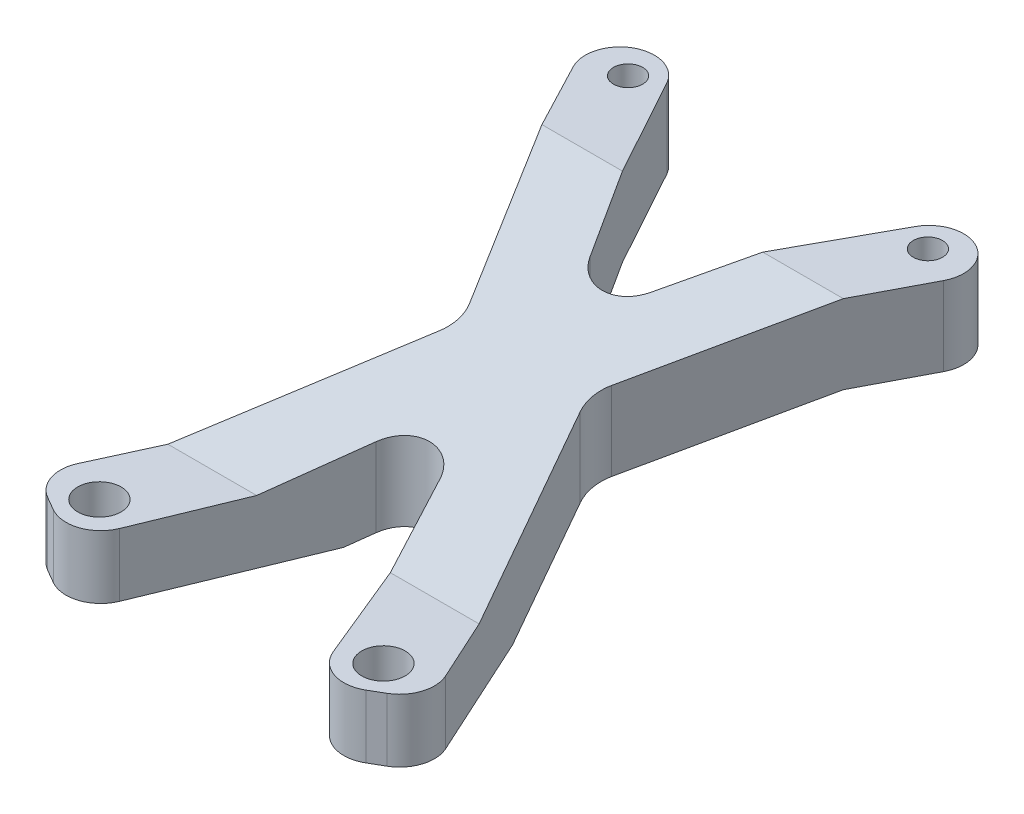
from build123d import *

# Parameters (mm, degrees)
SKETCH1_W               = 26
SKETCH1_H               = 41
SKETCH1_R               = 1.375
SKETCH1_R_2             = 0.925
SKETCH1_H_2             = 4.4
BOSS_EXTRUDE1_DEPTH     = 6
SKETCH2_R               = 0.925
SKETCH2_R_2             = 1.375
BOSS_EXTRUDE2_DEPTH     = 15
CUT_EXTRUDE2_DEPTH      = 42.677451937
CUT_EXTRUDE2_DEPTH_BACK = 42.677451937
SKETCH4_W               = 26
SKETCH4_H               = 45.4
CUT_EXTRUDE1_DEPTH      = 7
FILLET1_R               = 2.2
FILLET2_R               = 2.2


with BuildPart() as part:
    # Sketch1 → Boss-Extrude1 (new body)
    # profile 1 of 2: a face of its own
    with BuildSketch(Plane(origin=(0, 0, 0), x_dir=(1, 0, 0), z_dir=(0, 1, 0))):
        Rectangle(SKETCH1_W, SKETCH1_H)
        with Locations(Location((-9, -18, 0), (0, 0, 270))):
            Circle(SKETCH1_R, mode=Mode.SUBTRACT)
        with BuildLine():
            ThreePointArc((10.375, -18), (9, -19.375), (7.625, -18))
            ThreePointArc((7.625, -18), (9, -16.625), (10.375, -18))
        make_face(mode=Mode.SUBTRACT)
        with Locations(Location((-9.5, 16, 0), (0, 0, 270))):
            Circle(SKETCH1_R_2, mode=Mode.SUBTRACT)
        with BuildLine():
            ThreePointArc((10.425, 16), (9.5, 15.075), (8.575, 16))
            ThreePointArc((8.575, 16), (9.5, 16.925), (10.425, 16))
        make_face(mode=Mode.SUBTRACT)
    # profile 2 of 2: a face of its own
    with BuildSketch(Plane(origin=(0, 0, 0), x_dir=(1, 0, 0), z_dir=(0, 1, 0))):
        with Locations((0, -22.7)):
            Rectangle(SKETCH1_W, SKETCH1_H_2)
    extrude(amount=BOSS_EXTRUDE1_DEPTH)

    # Sketch2 → Boss-Extrude2 (add)
    # profile 1 of 6: a face of its own
    with BuildSketch(Plane(origin=(0, 6, 0), x_dir=(1, 0, 0), z_dir=(0, 1, 0))):
        Polygon((12.587244228, 16.385905528), (10.85066935, 17.736574878), (9.114094472, 19.087244228), (0, 2.5), (4, 2.5), (4, 0), align=None)
        with BuildLine():
            ThreePointArc((10.425, 16), (8.669058384, 15.593599912), (10.067895068, 16.730150801))
            ThreePointArc((10.067895068, 16.730150801), (10.330941616, 16.406400088), (10.425, 16))
        make_face(mode=Mode.SUBTRACT)
    # profile 2 of 6: a face of its own
    with BuildSketch(Plane(origin=(0, 6, 0), x_dir=(1, 0, 0), z_dir=(0, 1, 0))):
        Polygon((-4, 0), (-4, 2.5), (0, 2.5), (-9.114094472, 19.087244228), (-12.587244228, 16.385905528), align=None)
        with Locations(Location((-9.5, 16, 0), (0, 0, 270))):
            Circle(SKETCH2_R, mode=Mode.SUBTRACT)
    # profile 3 of 6: a face of its own
    with BuildSketch(Plane(origin=(0, 6, 0), x_dir=(1, 0, 0), z_dir=(0, 1, 0))):
        Polygon((0, 2.5), (-4, 2.5), (-4, 0), (-4, -2.5), (0, -2.5), align=None)
    # profile 4 of 6: a face of its own
    with BuildSketch(Plane(origin=(0, 6, 0), x_dir=(1, 0, 0), z_dir=(0, 1, 0))):
        Polygon((4, 2.5), (0, 2.5), (0, -2.5), (4, -2.5), (4, 0), align=None)
    # profile 5 of 6: a face of its own
    with BuildSketch(Plane(origin=(0, 6, 0), x_dir=(1, 0, 0), z_dir=(0, 1, 0))):
        Polygon((12.482501962, -18.524099305), (4, 0), (4, -2.5), (0, -2.5), (7.724231954, -21.282516701), (10.103366958, -19.903308003), align=None)
        with BuildLine():
            ThreePointArc((10.375, -18), (10.191392249, -18.686447019), (9.689604349, -19.189567502))
            ThreePointArc((9.689604349, -19.189567502), (7.808607751, -17.313552981), (10.375, -18))
        make_face(mode=Mode.SUBTRACT)
    # profile 6 of 6: a face of its own
    with BuildSketch(Plane(origin=(0, 6, 0), x_dir=(1, 0, 0), z_dir=(0, 1, 0))):
        Polygon((-4, -2.5), (-4, 0), (-12.482501962, -18.524099305), (-7.724231954, -21.282516701), (0, -2.5), align=None)
        with Locations(Location((-9, -18, 0), (0, 0, 270))):
            Circle(SKETCH2_R_2, mode=Mode.SUBTRACT)
    extrude(amount=BOSS_EXTRUDE2_DEPTH)

    # Sketch6 → Cut-Extrude2 (cut, two sides: drawn at the far end of the back side and taken through both)
    with BuildSketch(Plane(origin=(13, 0, 0), x_dir=(0, 0, -1), z_dir=(1, 0, 0)).offset(-CUT_EXTRUDE2_DEPTH_BACK)):
        Polygon((-21.28, 17), (-21.28, 11), (-12.8, 11), (10.59, 17), align=None)
        Polygon((10.59, 12), (-12.8, 6), (19.09, 6), (19.09, 12), align=None)
        Polygon((-21.28, 21.511868699), (-21.28, 17), (10.59, 17), (19.087244228, 17), (19.087244228, 21.511868699), align=None)
    extrude(amount=CUT_EXTRUDE2_DEPTH + CUT_EXTRUDE2_DEPTH_BACK, mode=Mode.SUBTRACT)

    # Sketch4 → Cut-Extrude1 (cut)
    with BuildSketch(Plane.XZ):
        with Locations((0, 2.2)):
            Rectangle(SKETCH4_W, SKETCH4_H)
    extrude(amount=-CUT_EXTRUDE1_DEPTH, mode=Mode.SUBTRACT)

    # Fillet1
    # the kernel refuses this fillet: 2.2 mm, written as the material it takes off along each edge
    with BuildSketch(Plane(origin=(12.587244228, 7.402722975, -16.385905528), x_dir=(-0.46418305146339667, 0, 0.8857392927572592), z_dir=(0, 1, 0))) as fillet1_piece_1:
        with BuildLine():
            CenterArc((FILLET1_R * 0.83586855008, -FILLET1_R), FILLET1_R, 90, 79.782379698)
            Line((-FILLET1_R * 0.148272552074, -FILLET1_R * 0.822612596131), (0, 0))
            Line((0, 0), (FILLET1_R * 0.83586855008, 0))
        make_face()
    extrude(amount=14.194554051, mode=Mode.SUBTRACT)
    with BuildSketch(Plane(origin=(9.114094472, 5.550330565, -19.087244228), x_dir=(-0.48155808709989106, 0, 0.8764141764877459), z_dir=(0, 1, 0))) as fillet1_piece_2:
        with BuildLine():
            CenterArc((FILLET1_R * 1.17266716994, FILLET1_R), FILLET1_R, 170.912229019, 99.087770981)
            Line((FILLET1_R * 0.185219628956, FILLET1_R * 1.15794731336), (0, 0))
            Line((0, 0), (FILLET1_R * 1.17266716994, 0))
        make_face()
    extrude(amount=17.899338869, mode=Mode.SUBTRACT)
    with BuildSketch(Plane(origin=(-9.114094472, 5.550330565, -19.087244228), x_dir=(0.4815580870998917, 0, 0.8764141764877456), z_dir=(0, 1, 0))) as fillet1_piece_3:
        with BuildLine():
            CenterArc((FILLET1_R * 1.17266716994, -FILLET1_R), FILLET1_R, 90, 99.087770981)
            Line((FILLET1_R * 0.185219628956, -FILLET1_R * 1.15794731336), (0, 0))
            Line((0, 0), (FILLET1_R * 1.17266716994, 0))
        make_face()
    extrude(amount=17.899338869, mode=Mode.SUBTRACT)
    with BuildSketch(Plane(origin=(-12.587244228, 7.402722975, -16.385905528), x_dir=(0.46418305146339667, 0, 0.8857392927572592), z_dir=(0, 1, 0))) as fillet1_piece_4:
        with BuildLine():
            CenterArc((FILLET1_R * 0.83586855008, FILLET1_R), FILLET1_R, 190.217620302, 79.782379698)
            Line((-FILLET1_R * 0.148272552074, FILLET1_R * 0.822612596131), (0, 0))
            Line((0, 0), (FILLET1_R * 0.83586855008, 0))
        make_face()
    extrude(amount=14.194554051, mode=Mode.SUBTRACT)
    with BuildSketch(Plane(origin=(-12.482501962, 2.003928442, 18.524099305), x_dir=(0.4163419464168799, 0, -0.9092081080004752), z_dir=(0, 1, 0))) as fillet1_piece_5:
        with BuildLine():
            CenterArc((FILLET1_R * 0.908376646875, -FILLET1_R), FILLET1_R, 90, 84.502549141)
            Line((-FILLET1_R * 0.087023814771, -FILLET1_R * 0.904198533648), (0, 0))
            Line((0, 0), (FILLET1_R * 0.908376646875, 0))
        make_face()
    extrude(amount=13.992143116, mode=Mode.SUBTRACT)
    with BuildSketch(Plane(origin=(-7.724231954, 0.701160202, 21.282516701), x_dir=(0.3803394674675552, 0, -0.9248469546289788), z_dir=(0, 1, 0))) as fillet1_piece_6:
        with BuildLine():
            CenterArc((FILLET1_R * 1.14524359963, FILLET1_R), FILLET1_R, 172.25340707, 97.74659293)
            Line((FILLET1_R * 0.154369685137, FILLET1_R * 1.13479200861), (0, 0))
            Line((0, 0), (FILLET1_R * 1.14524359963, 0))
        make_face()
    extrude(amount=26.597679596, mode=Mode.SUBTRACT)
    with BuildSketch(Plane(origin=(12.482501962, 2.003928442, 18.524099305), x_dir=(-0.4163419464168806, 0, -0.9092081080004749), z_dir=(0, 1, 0))) as fillet1_piece_7:
        with BuildLine():
            CenterArc((FILLET1_R * 0.908376646875, FILLET1_R), FILLET1_R, 185.497450859, 84.502549141)
            Line((-FILLET1_R * 0.087023814771, FILLET1_R * 0.904198533648), (0, 0))
            Line((0, 0), (FILLET1_R * 0.908376646875, 0))
        make_face()
    extrude(amount=13.992143116, mode=Mode.SUBTRACT)
    with BuildSketch(Plane(origin=(7.724231954, 0.701160202, 21.282516701), x_dir=(-0.38033946746755576, 0, -0.9248469546289787), z_dir=(0, 1, 0))) as fillet1_piece_8:
        with BuildLine():
            CenterArc((FILLET1_R * 1.14524359963, -FILLET1_R), FILLET1_R, 90, 97.74659293)
            Line((FILLET1_R * 0.154369685137, -FILLET1_R * 1.13479200861), (0, 0))
            Line((0, 0), (FILLET1_R * 1.14524359963, 0))
        make_face()
    extrude(amount=26.597679596, mode=Mode.SUBTRACT)

    # Fillet2
    fillet2_edges = [part.edges().sort_by_distance(p)[0] for p in [
        (-4, 11.783454468, 0),
        (0, 12.424754168, -2.5),
        (4, 11.783454468, 0),
        (0, 11.142154767, 2.5),
    ]]
    fillet(fillet2_edges, radius=FILLET2_R)


solid = part.part
